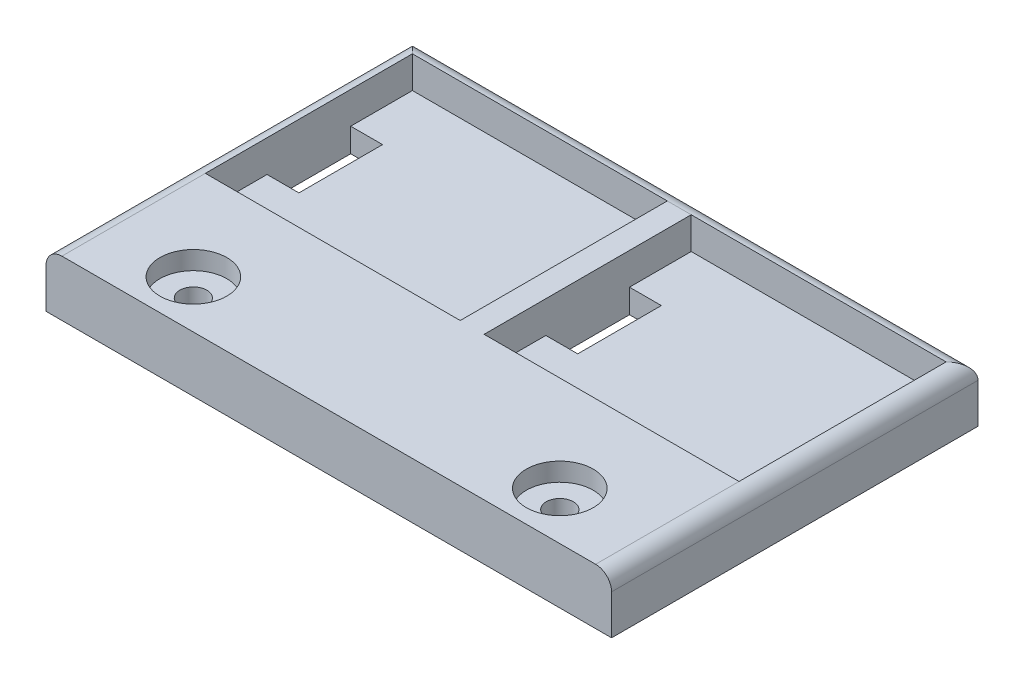
from build123d import *

# Parameters (mm, degrees)
SKETCH1_W                                        = 71
SKETCH1_H                                        = 46
SKETCH1_W_2                                      = 32
SKETCH1_H_2                                      = 26
BOSS_EXTRUDE1_DEPTH                              = 7
SKETCH1_2_W                                      = 32
SKETCH1_2_H                                      = 26
BOSS_EXTRUDE2_DEPTH                              = 3
CBORE_FOR_M3_HEX_HEAD_MACHINE_SCREW1_D           = 3.4
CBORE_FOR_M3_HEX_HEAD_MACHINE_SCREW1_CBORE_D     = 8.4
CBORE_FOR_M3_HEX_HEAD_MACHINE_SCREW1_CBORE_DEPTH = 2.3
SKETCH6_W                                        = 4
SKETCH6_H                                        = 10.5
CUT_EXTRUDE1_DEPTH                               = 43.488233665
FILLET1_R                                        = 2


with BuildPart() as part:
    # Sketch1 → Boss-Extrude1 (new body)
    with BuildSketch(Plane(origin=(0, 0, 0), x_dir=(1, 0, 0), z_dir=(0, 1, 0))):
        Rectangle(SKETCH1_W, SKETCH1_H)
        with Locations((-17.5, 8)):
            Rectangle(SKETCH1_W_2, SKETCH1_H_2, mode=Mode.SUBTRACT)
        with Locations((17.5, 8)):
            Rectangle(SKETCH1_W_2, SKETCH1_H_2, mode=Mode.SUBTRACT)
    extrude(amount=BOSS_EXTRUDE1_DEPTH)

    # Sketch1<2> → Boss-Extrude2 (add)
    with BuildSketch(Plane(origin=(0, 0, 0), x_dir=(1, 0, 0), z_dir=(0, 1, 0))):
        with Locations((-17.5, 8)):
            Rectangle(SKETCH1_2_W, SKETCH1_2_H)
        with Locations((17.5, 8)):
            Rectangle(SKETCH1_2_W, SKETCH1_2_H)
    extrude(amount=BOSS_EXTRUDE2_DEPTH)

    # CBORE for M3 Hex Head Machine Screw1 (through all)
    with Locations(Plane(origin=(0, 7, 0), x_dir=(1, 0, 0), z_dir=(0, 1, 0))):
        with Locations((-23, -17), (23, -17)):
            CounterBoreHole(CBORE_FOR_M3_HEX_HEAD_MACHINE_SCREW1_D / 2, CBORE_FOR_M3_HEX_HEAD_MACHINE_SCREW1_CBORE_D / 2, CBORE_FOR_M3_HEX_HEAD_MACHINE_SCREW1_CBORE_DEPTH)

    # Sketch6 → Cut-Extrude1 (cut, through all)
    with BuildSketch(Plane(origin=(0, 3, 0), x_dir=(1, 0, 0), z_dir=(0, 1, 0))):
        with Locations((-31.5, 8)):
            Rectangle(SKETCH6_W, SKETCH6_H)
        with Locations((-3.5, 8)):
            Rectangle(SKETCH6_W, SKETCH6_H)
        with Locations((3.5, 8)):
            Rectangle(SKETCH6_W, SKETCH6_H)
        with Locations((31.5, 8)):
            Rectangle(SKETCH6_W, SKETCH6_H)
    extrude(amount=-CUT_EXTRUDE1_DEPTH, mode=Mode.SUBTRACT)

    # Fillet1
    fillet1_edges = [part.edges().sort_by_distance(p)[0] for p in [
        (-35.5, 7, 0),
        (35.5, 7, 0),
        (0, 7, -23),
    ]]
    fillet(fillet1_edges, radius=FILLET1_R - 0.0001)  # a hair under: the kernel refuses the full size


solid = part.part
